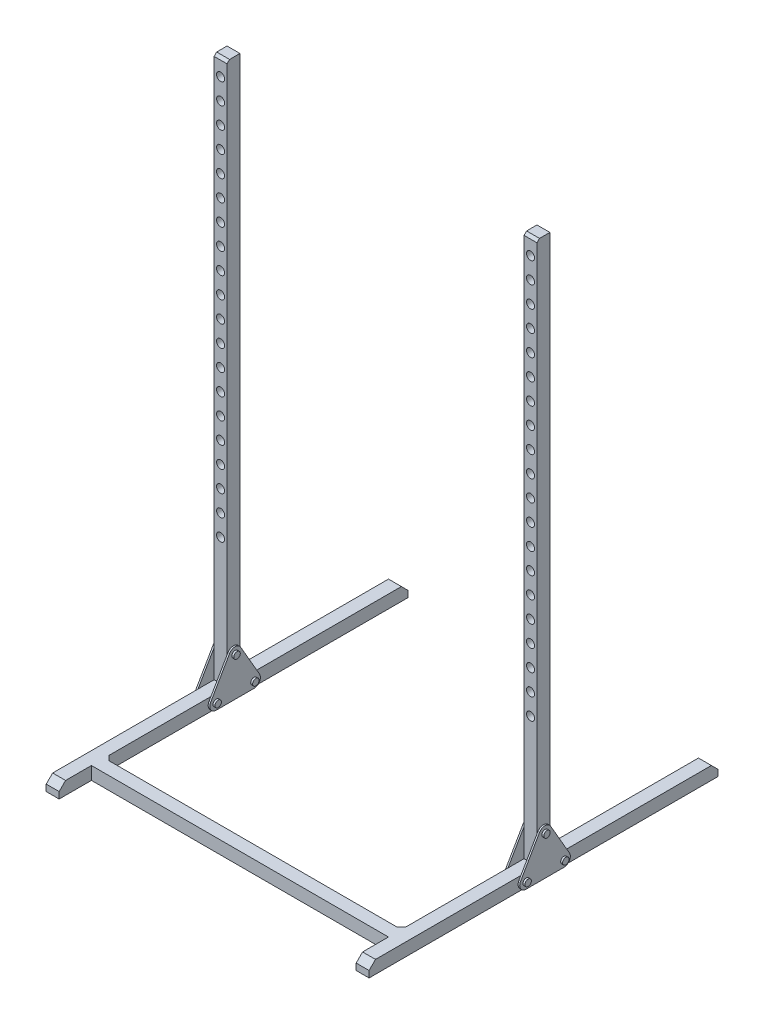
from build123d import *

# Parameters (mm, degrees)
SKETCH1_W                = 50.8
SKETCH1_H                = 50.8
BOSS_EXTRUDE1_DEPTH      = 1371.6
SKETCH2_W                = 50.8
SKETCH2_H                = 50.8
BOSS_EXTRUDE2_DEPTH      = 1168.4
SKETCH3_W                = 50.8
SKETCH3_H                = 50.8
BOSS_EXTRUDE3_DEPTH      = 2133.6
BOSS_EXTRUDE4_DEPTH      = 6.35
FILLET1_R                = 25.4
FILLET2_R                = 25.4
MIRROR4_COPY_1_DEPTH     = 6.35
FILLET3_R                = 25.4
CHAMFER1_SIZE            = 25.24
CHAMFER2_SIZE            = 17.62
SKETCH7_R                = 15.875
CUT_EXTRUDE1_DEPTH       = 2595.602540371
LPATTERN1_COUNT          = 20
LPATTERN1_PITCH          = 82.55
MIRROR5_COPY_1_SKETCH_R  = 15.875
MIRROR5_COPY_1_DEPTH     = 2595.602540371
MIRROR5_COPY_2_SKETCH_R  = 15.875
MIRROR5_COPY_2_DEPTH     = 2595.602540371
MIRROR5_COPY_3_SKETCH_R  = 15.875
MIRROR5_COPY_3_DEPTH     = 2595.602540371
MIRROR5_COPY_4_SKETCH_R  = 15.875
MIRROR5_COPY_4_DEPTH     = 2595.602540371
MIRROR5_COPY_5_SKETCH_R  = 15.875
MIRROR5_COPY_5_DEPTH     = 2595.602540371
MIRROR5_COPY_6_SKETCH_R  = 15.875
MIRROR5_COPY_6_DEPTH     = 2595.602540371
MIRROR5_COPY_7_SKETCH_R  = 15.875
MIRROR5_COPY_7_DEPTH     = 2595.602540371
MIRROR5_COPY_8_SKETCH_R  = 15.875
MIRROR5_COPY_8_DEPTH     = 2595.602540371
MIRROR5_COPY_9_SKETCH_R  = 15.875
MIRROR5_COPY_9_DEPTH     = 2595.602540371
MIRROR5_COPY_10_SKETCH_R = 15.875
MIRROR5_COPY_10_DEPTH    = 2595.602540371
MIRROR5_COPY_11_SKETCH_R = 15.875
MIRROR5_COPY_11_DEPTH    = 2595.602540371
MIRROR5_COPY_12_SKETCH_R = 15.875
MIRROR5_COPY_12_DEPTH    = 2595.602540371
MIRROR5_COPY_13_SKETCH_R = 15.875
MIRROR5_COPY_13_DEPTH    = 2595.602540371
MIRROR5_COPY_14_SKETCH_R = 15.875
MIRROR5_COPY_14_DEPTH    = 2595.602540371
MIRROR5_COPY_15_SKETCH_R = 15.875
MIRROR5_COPY_15_DEPTH    = 2595.602540371
MIRROR5_COPY_16_SKETCH_R = 15.875
MIRROR5_COPY_16_DEPTH    = 2595.602540371
MIRROR5_COPY_17_SKETCH_R = 15.875
MIRROR5_COPY_17_DEPTH    = 2595.602540371
MIRROR5_COPY_18_SKETCH_R = 15.875
MIRROR5_COPY_18_DEPTH    = 2595.602540371
MIRROR5_COPY_19_SKETCH_R = 15.875
MIRROR5_COPY_19_DEPTH    = 2595.602540371
MIRROR5_COPY_20_SKETCH_R = 15.875
MIRROR5_COPY_20_DEPTH    = 2595.602540371
SKETCH8_R                = 12.7
BOSS_EXTRUDE5_DEPTH      = 7.62
MIRROR7_COPY_1_SKETCH_R  = 12.7
MIRROR7_COPY_1_DEPTH     = 7.62
MIRROR7_COPY_2_SKETCH_R  = 12.7
MIRROR7_COPY_2_DEPTH     = 7.62
CHAMFER3_SIZE            = 10


with BuildPart() as part:
    # Sketch1 → Boss-Extrude1 (new body)
    with BuildSketch(Plane.XY):
        Rectangle(SKETCH1_W, SKETCH1_H)
    boss_extrude1 = extrude(amount=BOSS_EXTRUDE1_DEPTH)

    # Sketch2 → Boss-Extrude2 (add)
    with BuildSketch(Plane(origin=(25.4, 0, 0), x_dir=(0, 0, -1), z_dir=(1, 0, 0))):
        with Locations((-1219.228406196, 0)):
            Rectangle(SKETCH2_W, SKETCH2_H)
    extrude(amount=BOSS_EXTRUDE2_DEPTH)

    # Mirror1: Boss-Extrude1 across plane
    add(boss_extrude1.mirror(Plane(origin=(609.6, 0, 0), x_dir=(0, 0, 1), z_dir=(1, 0, 0))))

    # Sketch3 → Boss-Extrude3 (add)
    with BuildSketch(Plane(origin=(0, 25.4, 0), x_dir=(1, 0, 0), z_dir=(0, 1, 0))):
        with Locations((0, -685.8)):
            Rectangle(SKETCH3_W, SKETCH3_H)
    boss_extrude3 = extrude(amount=BOSS_EXTRUDE3_DEPTH)

    # Sketch4 → Boss-Extrude4 (add)
    with BuildSketch(Plane.ZY.offset(25.4)):
        Polygon((567.684689222, -25.4), (803.915310778, -25.4), (685.8, 179.181719419), align=None)
    boss_extrude4 = extrude(amount=BOSS_EXTRUDE4_DEPTH)

    # Fillet1
    fillet1_edges = [part.edges().sort_by_distance(p)[0] for p in [
        (-28.575, -25.4, 567.684689222),
        (-28.575, -25.4, 803.915310778),
        (-28.575, 179.181719419, 685.8),
    ]]
    fillet(fillet1_edges, radius=FILLET1_R)

    # Mirror2: Boss-Extrude4 across plane
    add(boss_extrude4.mirror(Plane(origin=(0, 0, 0), x_dir=(0, 0, 1), z_dir=(1, 0, 0))))

    # Fillet2
    fillet2_edges = [part.edges().sort_by_distance(p)[0] for p in [
        (28.575, -25.4, 803.915310778),
        (28.575, -25.4, 567.684689222),
        (28.575, 179.181719419, 685.8),
    ]]
    fillet(fillet2_edges, radius=FILLET2_R)

    # Mirror4: Boss-Extrude3, Boss-Extrude4 across plane
    add(boss_extrude3.mirror(Plane(origin=(609.6, 0, 0), x_dir=(0, 0, 1), z_dir=(1, 0, 0))))
    add(boss_extrude4.mirror(Plane(origin=(609.6, 0, 0), x_dir=(0, 0, 1), z_dir=(1, 0, 0))))

    # Mirror4 copy 1 sketch → Mirror4 copy 1 (add)
    with BuildSketch(Plane.ZY.offset(-1193.8)):
        Polygon((567.684689222, -25.4), (803.915310778, -25.4), (685.8, 179.181719419), align=None)
    extrude(amount=MIRROR4_COPY_1_DEPTH)

    # Fillet3
    fillet3_edges = [part.edges().sort_by_distance(p)[0] for p in [
        (1247.775, -25.4, 803.915310778),
        (1190.625, -25.4, 803.915310778),
        (1190.625, -25.4, 567.684689222),
        (1247.775, -25.4, 567.684689222),
        (1247.775, 179.181719419, 685.8),
        (1190.625, 179.181719419, 685.8),
    ]]
    fillet(fillet3_edges, radius=FILLET3_R)

    # Chamfer1
    chamfer1_edges = [part.edges().sort_by_distance(p)[0] for p in [
        (1219.2, 25.4, 1371.6),
        (0, 25.4, 1371.6),
        (0, 25.4, 0),
        (1219.2, 25.4, 0),
    ]]
    chamfer(chamfer1_edges, length=CHAMFER1_SIZE)

    # Chamfer2
    chamfer2_edges = [part.edges().sort_by_distance(p)[0] for p in [
        (25.4, 0, 1193.828406196),
        (1193.8, 0, 1193.828406196),
    ]]
    chamfer(chamfer2_edges, length=CHAMFER2_SIZE)

    # Sketch7 → Cut-Extrude1 (cut, through all)
    with BuildSketch(Plane(origin=(0, 0, 660.4), x_dir=(-1, 0, 0), z_dir=(0, 0, -1))):
        with Locations((0, 2092.325)):
            Circle(SKETCH7_R)
    cut_extrude1 = extrude(amount=-CUT_EXTRUDE1_DEPTH, mode=Mode.SUBTRACT)

    # LPattern1: Cut-Extrude1 ×20
    with Locations(*[(0, -i * LPATTERN1_PITCH, 0) for i in range(1, LPATTERN1_COUNT)]):
        add(cut_extrude1, mode=Mode.SUBTRACT)

    # Mirror5 copy 1 sketch → Mirror5 copy 1 (cut, through all)
    with BuildSketch(Plane(origin=(1219.2, -82.55, 660.4), x_dir=(1, 0, 0), z_dir=(0, 0, -1))):
        with Locations((0, -2092.325)):
            Circle(MIRROR5_COPY_1_SKETCH_R)
    extrude(amount=-MIRROR5_COPY_1_DEPTH, mode=Mode.SUBTRACT)

    # Mirror5 copy 2 sketch → Mirror5 copy 2 (cut, through all)
    with BuildSketch(Plane(origin=(1219.2, -165.1, 660.4), x_dir=(1, 0, 0), z_dir=(0, 0, -1))):
        with Locations((0, -2092.325)):
            Circle(MIRROR5_COPY_2_SKETCH_R)
    extrude(amount=-MIRROR5_COPY_2_DEPTH, mode=Mode.SUBTRACT)

    # Mirror5 copy 3 sketch → Mirror5 copy 3 (cut, through all)
    with BuildSketch(Plane(origin=(1219.2, -247.65, 660.4), x_dir=(1, 0, 0), z_dir=(0, 0, -1))):
        with Locations((0, -2092.325)):
            Circle(MIRROR5_COPY_3_SKETCH_R)
    extrude(amount=-MIRROR5_COPY_3_DEPTH, mode=Mode.SUBTRACT)

    # Mirror5 copy 4 sketch → Mirror5 copy 4 (cut, through all)
    with BuildSketch(Plane(origin=(1219.2, -330.2, 660.4), x_dir=(1, 0, 0), z_dir=(0, 0, -1))):
        with Locations((0, -2092.325)):
            Circle(MIRROR5_COPY_4_SKETCH_R)
    extrude(amount=-MIRROR5_COPY_4_DEPTH, mode=Mode.SUBTRACT)

    # Mirror5 copy 5 sketch → Mirror5 copy 5 (cut, through all)
    with BuildSketch(Plane(origin=(1219.2, -412.75, 660.4), x_dir=(1, 0, 0), z_dir=(0, 0, -1))):
        with Locations((0, -2092.325)):
            Circle(MIRROR5_COPY_5_SKETCH_R)
    extrude(amount=-MIRROR5_COPY_5_DEPTH, mode=Mode.SUBTRACT)

    # Mirror5 copy 6 sketch → Mirror5 copy 6 (cut, through all)
    with BuildSketch(Plane(origin=(1219.2, -495.3, 660.4), x_dir=(1, 0, 0), z_dir=(0, 0, -1))):
        with Locations((0, -2092.325)):
            Circle(MIRROR5_COPY_6_SKETCH_R)
    extrude(amount=-MIRROR5_COPY_6_DEPTH, mode=Mode.SUBTRACT)

    # Mirror5 copy 7 sketch → Mirror5 copy 7 (cut, through all)
    with BuildSketch(Plane(origin=(1219.2, -577.85, 660.4), x_dir=(1, 0, 0), z_dir=(0, 0, -1))):
        with Locations((0, -2092.325)):
            Circle(MIRROR5_COPY_7_SKETCH_R)
    extrude(amount=-MIRROR5_COPY_7_DEPTH, mode=Mode.SUBTRACT)

    # Mirror5 copy 8 sketch → Mirror5 copy 8 (cut, through all)
    with BuildSketch(Plane(origin=(1219.2, -660.4, 660.4), x_dir=(1, 0, 0), z_dir=(0, 0, -1))):
        with Locations((0, -2092.325)):
            Circle(MIRROR5_COPY_8_SKETCH_R)
    extrude(amount=-MIRROR5_COPY_8_DEPTH, mode=Mode.SUBTRACT)

    # Mirror5 copy 9 sketch → Mirror5 copy 9 (cut, through all)
    with BuildSketch(Plane(origin=(1219.2, -742.95, 660.4), x_dir=(1, 0, 0), z_dir=(0, 0, -1))):
        with Locations((0, -2092.325)):
            Circle(MIRROR5_COPY_9_SKETCH_R)
    extrude(amount=-MIRROR5_COPY_9_DEPTH, mode=Mode.SUBTRACT)

    # Mirror5 copy 10 sketch → Mirror5 copy 10 (cut, through all)
    with BuildSketch(Plane(origin=(1219.2, -825.5, 660.4), x_dir=(1, 0, 0), z_dir=(0, 0, -1))):
        with Locations((0, -2092.325)):
            Circle(MIRROR5_COPY_10_SKETCH_R)
    extrude(amount=-MIRROR5_COPY_10_DEPTH, mode=Mode.SUBTRACT)

    # Mirror5 copy 11 sketch → Mirror5 copy 11 (cut, through all)
    with BuildSketch(Plane(origin=(1219.2, -908.05, 660.4), x_dir=(1, 0, 0), z_dir=(0, 0, -1))):
        with Locations((0, -2092.325)):
            Circle(MIRROR5_COPY_11_SKETCH_R)
    extrude(amount=-MIRROR5_COPY_11_DEPTH, mode=Mode.SUBTRACT)

    # Mirror5 copy 12 sketch → Mirror5 copy 12 (cut, through all)
    with BuildSketch(Plane(origin=(1219.2, -990.6, 660.4), x_dir=(1, 0, 0), z_dir=(0, 0, -1))):
        with Locations((0, -2092.325)):
            Circle(MIRROR5_COPY_12_SKETCH_R)
    extrude(amount=-MIRROR5_COPY_12_DEPTH, mode=Mode.SUBTRACT)

    # Mirror5 copy 13 sketch → Mirror5 copy 13 (cut, through all)
    with BuildSketch(Plane(origin=(1219.2, -1073.15, 660.4), x_dir=(1, 0, 0), z_dir=(0, 0, -1))):
        with Locations((0, -2092.325)):
            Circle(MIRROR5_COPY_13_SKETCH_R)
    extrude(amount=-MIRROR5_COPY_13_DEPTH, mode=Mode.SUBTRACT)

    # Mirror5 copy 14 sketch → Mirror5 copy 14 (cut, through all)
    with BuildSketch(Plane(origin=(1219.2, -1155.7, 660.4), x_dir=(1, 0, 0), z_dir=(0, 0, -1))):
        with Locations((0, -2092.325)):
            Circle(MIRROR5_COPY_14_SKETCH_R)
    extrude(amount=-MIRROR5_COPY_14_DEPTH, mode=Mode.SUBTRACT)

    # Mirror5 copy 15 sketch → Mirror5 copy 15 (cut, through all)
    with BuildSketch(Plane(origin=(1219.2, -1238.25, 660.4), x_dir=(1, 0, 0), z_dir=(0, 0, -1))):
        with Locations((0, -2092.325)):
            Circle(MIRROR5_COPY_15_SKETCH_R)
    extrude(amount=-MIRROR5_COPY_15_DEPTH, mode=Mode.SUBTRACT)

    # Mirror5 copy 16 sketch → Mirror5 copy 16 (cut, through all)
    with BuildSketch(Plane(origin=(1219.2, -1320.8, 660.4), x_dir=(1, 0, 0), z_dir=(0, 0, -1))):
        with Locations((0, -2092.325)):
            Circle(MIRROR5_COPY_16_SKETCH_R)
    extrude(amount=-MIRROR5_COPY_16_DEPTH, mode=Mode.SUBTRACT)

    # Mirror5 copy 17 sketch → Mirror5 copy 17 (cut, through all)
    with BuildSketch(Plane(origin=(1219.2, -1403.35, 660.4), x_dir=(1, 0, 0), z_dir=(0, 0, -1))):
        with Locations((0, -2092.325)):
            Circle(MIRROR5_COPY_17_SKETCH_R)
    extrude(amount=-MIRROR5_COPY_17_DEPTH, mode=Mode.SUBTRACT)

    # Mirror5 copy 18 sketch → Mirror5 copy 18 (cut, through all)
    with BuildSketch(Plane(origin=(1219.2, -1485.9, 660.4), x_dir=(1, 0, 0), z_dir=(0, 0, -1))):
        with Locations((0, -2092.325)):
            Circle(MIRROR5_COPY_18_SKETCH_R)
    extrude(amount=-MIRROR5_COPY_18_DEPTH, mode=Mode.SUBTRACT)

    # Mirror5 copy 19 sketch → Mirror5 copy 19 (cut, through all)
    with BuildSketch(Plane(origin=(1219.2, -1568.45, 660.4), x_dir=(1, 0, 0), z_dir=(0, 0, -1))):
        with Locations((0, -2092.325)):
            Circle(MIRROR5_COPY_19_SKETCH_R)
    extrude(amount=-MIRROR5_COPY_19_DEPTH, mode=Mode.SUBTRACT)

    # Mirror5 copy 20 sketch → Mirror5 copy 20 (cut, through all)
    with BuildSketch(Plane(origin=(1219.2, 0, 660.4), x_dir=(1, 0, 0), z_dir=(0, 0, -1))):
        with Locations((0, -2092.325)):
            Circle(MIRROR5_COPY_20_SKETCH_R)
    extrude(amount=-MIRROR5_COPY_20_DEPTH, mode=Mode.SUBTRACT)

    # Sketch8 → Boss-Extrude5 (add)
    with BuildSketch(Plane.ZY.offset(31.75)):
        with Locations((685.8, 128.381719419)):
            Circle(SKETCH8_R)
        with Locations((611.678779734, 0)):
            Circle(SKETCH8_R)
        with Locations((759.921220266, 0)):
            Circle(SKETCH8_R)
    boss_extrude5 = extrude(amount=BOSS_EXTRUDE5_DEPTH)

    # Mirror6: Boss-Extrude5 across plane
    add(boss_extrude5.mirror(Plane(origin=(0, 0, 0), x_dir=(0, 0, 1), z_dir=(1, 0, 0))))

    # Mirror7 copy 1 sketch → Mirror7 copy 1 (add)
    with BuildSketch(Plane.ZY.offset(-1187.45)):
        with Locations((685.8, 128.381719419)):
            Circle(MIRROR7_COPY_1_SKETCH_R)
        with Locations((611.678779734, 0)):
            Circle(MIRROR7_COPY_1_SKETCH_R)
        with Locations((759.921220266, 0)):
            Circle(MIRROR7_COPY_1_SKETCH_R)
    extrude(amount=MIRROR7_COPY_1_DEPTH)

    # Mirror7 copy 2 sketch → Mirror7 copy 2 (add)
    with BuildSketch(Plane(origin=(1250.95, 0, 0), x_dir=(0, 0, 1), z_dir=(1, 0, 0))):
        with Locations((685.8, -128.381719419)):
            Circle(MIRROR7_COPY_2_SKETCH_R)
        with Locations((611.678779734, 0)):
            Circle(MIRROR7_COPY_2_SKETCH_R)
        with Locations((759.921220266, 0)):
            Circle(MIRROR7_COPY_2_SKETCH_R)
    extrude(amount=MIRROR7_COPY_2_DEPTH)

    # Chamfer3
    chamfer3_edges = [part.edges().sort_by_distance(p)[0] for p in [
        (0, 2159, 711.2),
        (1219.2, 2159, 711.2),
    ]]
    chamfer(chamfer3_edges, length=CHAMFER3_SIZE)


solid = part.part
